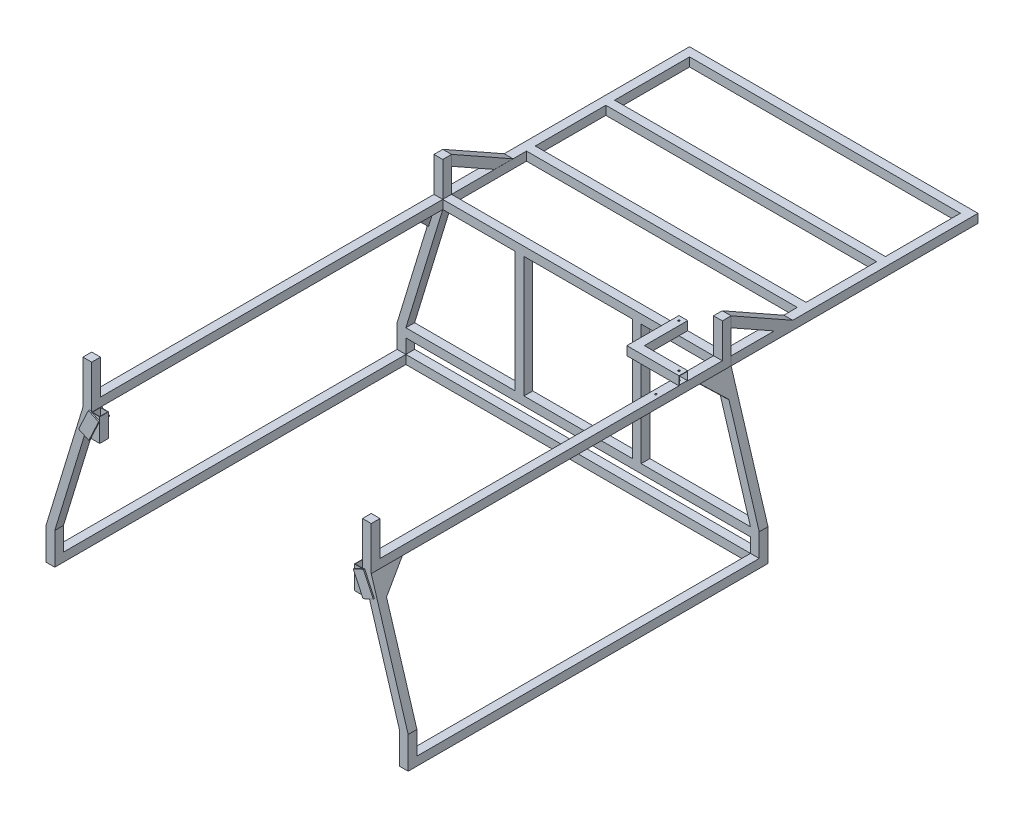
from build123d import *

# Parameters (mm, degrees)
EXTRUDE_THIN1_DEPTH  = 38
SKETCH3_W            = 38
SKETCH3_H            = 38
BOSS_EXTRUDE1_DEPTH  = 100
EXTRUDE_THIN2_DEPTH  = 38
SWEEP1_START         = 742
SWEEP1_DEPTH         = 38
SWEEP2_START         = 742
SWEEP2_DEPTH         = 38
SWEEP3_START         = -780
SWEEP3_DEPTH         = 38
SWEEP4_START         = -780
SWEEP4_DEPTH         = 38
SKETCH13_W           = 38
SKETCH13_H           = 38
BOSS_EXTRUDE2_DEPTH  = 150
RIB1_REACH           = 1837.226
SKETCH16_WALL_W      = 3809.630165696
SKETCH16_WALL_H      = 5
RIB2_REACH           = 1837.226
SKETCH21_WALL_W      = 3809.630165696
SKETCH21_WALL_H      = 5
SKETCH25_W           = 935.216872936
SKETCH25_H           = 953.548523314
CUT_EXTRUDE1_DEPTH   = 1943.247409575
SKETCH26_W           = 38
SKETCH26_H           = 38
SKETCH26_W_2         = 38.33862028
BOSS_EXTRUDE3_DEPTH  = 1070
BOSS_EXTRUDE4_REACH  = 2457.073
SKETCH27_W           = 38
SKETCH27_H           = 38
BOSS_EXTRUDE5_DEPTH  = 38
SKETCH29_W           = 38
SKETCH29_H           = 624
EXTRUDE_THIN3_DEPTH  = 38
SKETCH30_W           = 38
SKETCH30_H           = 624
EXTRUDE_THIN4_DEPTH  = 38
SKETCH31_W           = 1174
SKETCH31_H           = 38
EXTRUDE_THIN5_DEPTH  = 38
BOSS_EXTRUDE6_DEPTH  = 38
BOSS_EXTRUDE7_DEPTH  = 5
BOSS_EXTRUDE8_DEPTH  = 5
SKETCH35_W           = 34.947405688
SKETCH35_H           = 38
BOSS_EXTRUDE11_DEPTH = 100
SHELL1_T             = -1.5
SKETCH36_W           = 943.118643106
SKETCH36_H           = 1032.640089362
CUT_EXTRUDE2_DEPTH   = 2878.837729963
SKETCH38_R           = 4
CUT_EXTRUDE3_DEPTH   = 38
SKETCH40_W           = 31.947405688
SKETCH40_H           = 35
CUT_EXTRUDE5_DEPTH   = 2087.760407905
SKETCH41_W           = 31.947405688
SKETCH41_H           = 35
CUT_EXTRUDE6_DEPTH   = 2087.760407905
EXTRUDE_THIN7_DEPTH  = 38
SKETCH43_R           = 4
CUT_EXTRUDE7_DEPTH   = 2116.884921256
SKETCH45_W           = 34
SKETCH45_H           = 34
SKETCH49_W           = 38
SKETCH49_H           = 38
BOSS_EXTRUDE12_DEPTH = 1494
SKETCH50_W           = 38
SKETCH50_H           = 62
CUT_EXTRUDE8_DEPTH   = 1916.842895438


# Read off the part's stored shape, not the designer's step: Sweep1, Sweep2, Sweep3, Sweep4
with BuildPart() as part:
    # Sketch2 → Extrude-Thin1 (new body)
    with BuildSketch(Plane(origin=(0, 0, 0), x_dir=(1, 0, 0), z_dir=(0, 1, 0))):
        Polygon((785, -780), (785, 780), (-785, 780), (-785, -780), (-747, -780), (-747, 742), (747, 742), (747, -780), align=None)
    extrude(amount=EXTRUDE_THIN1_DEPTH)

    # Sketch3 → Boss-Extrude1 (add)
    with BuildSketch(Plane(origin=(0, 38, 0), x_dir=(1, 0, 0), z_dir=(0, 1, 0))):
        with Locations((-766, 761)):
            Rectangle(SKETCH3_W, SKETCH3_H)
        with Locations((766, 761)):
            Rectangle(SKETCH3_W, SKETCH3_H)
        with Locations((766, -761)):
            Rectangle(SKETCH3_W, SKETCH3_H)
        with Locations((-766, -761)):
            Rectangle(SKETCH3_W, SKETCH3_H)
    extrude(amount=BOSS_EXTRUDE1_DEPTH)



with BuildPart() as body_2:
    # Sketch4 → Extrude-Thin2 (new body)
    with BuildSketch(Plane(origin=(0, 700, 0), x_dir=(1, 0, 0), z_dir=(0, 1, 0))):
        Polygon((625, -780), (625, 780), (-625, 780), (-625, -780), (-587, -780), (-587, 742), (587, 742), (587, -780), align=None)
    extrude(amount=-EXTRUDE_THIN2_DEPTH)


with BuildPart() as part_1:
    add(part.part)

    add(body_2.part)  # Sweep1 merges body 2
    # Sweep1 outline → Sweep1 (add)
    with BuildSketch(Plane.XY.offset(SWEEP1_START)):
        Polygon((-587, 662), (-625, 662), (-785, 138), (-747, 138), align=None)
    extrude(amount=SWEEP1_DEPTH)

    # Sweep2 outline → Sweep2 (add)
    with BuildSketch(Plane.XY.offset(SWEEP2_START)):
        Polygon((747, 138), (785, 138), (625, 662), (587, 662), align=None)
    extrude(amount=SWEEP2_DEPTH)

    # Sweep3 outline → Sweep3 (add)
    with BuildSketch(Plane.XY.offset(SWEEP3_START)):
        Polygon((785, 138), (625, 662), (587, 662), (747, 138), align=None)
    extrude(amount=SWEEP3_DEPTH)

    # Sweep4 outline → Sweep4 (add)
    with BuildSketch(Plane.XY.offset(SWEEP4_START)):
        Polygon((-625, 662), (-785, 138), (-747, 138), (-587, 662), align=None)
    extrude(amount=SWEEP4_DEPTH)

    # Sketch13 → Boss-Extrude2 (add)
    with BuildSketch(Plane(origin=(0, 700, 0), x_dir=(1, 0, 0), z_dir=(0, 1, 0))):
        with Locations((-606, 761)):
            Rectangle(SKETCH13_W, SKETCH13_H)
        with Locations((-606, -761)):
            Rectangle(SKETCH13_W, SKETCH13_H)
        with Locations((606, 761)):
            Rectangle(SKETCH13_W, SKETCH13_H)
        with Locations((606, -761)):
            Rectangle(SKETCH13_W, SKETCH13_H)
    extrude(amount=BOSS_EXTRUDE2_DEPTH)

    # Sketch16 wall → Rib1 (add, up to next)
    with BuildSketch(Plane(origin=(-639.163602773, 615.614200918, 693.5), x_dir=(0.20649854777, 0.676282743952, -0.707106781188), z_dir=(-0.206498547772, -0.676282743954, -0.707106781186)), mode=Mode.PRIVATE) as rib1_sk1:
        with Locations((0, 2.5)):
            Rectangle(SKETCH16_WALL_W, SKETCH16_WALL_H)
    rib1_tool1 = extrude(rib1_sk1.sketch, amount=-RIB1_REACH, mode=Mode.PRIVATE) - part_1.part
    add(rib1_tool1.solids().sort_by_distance((-639.163602773, 615.614200918, 693.5))[0])

    # Sketch21 wall → Rib2 (add, up to next)
    with BuildSketch(Plane(origin=(-639.163602773, 615.614200918, -693.5), x_dir=(-0.20649854777, -0.676282743952, -0.707106781188), z_dir=(-0.206498547772, -0.676282743954, 0.707106781186)), mode=Mode.PRIVATE) as rib2_sk1:
        with Locations((0, 2.5)):
            Rectangle(SKETCH21_WALL_W, SKETCH21_WALL_H)
    rib2_tool1 = extrude(rib2_sk1.sketch, amount=-RIB2_REACH, mode=Mode.PRIVATE) - part_1.part
    add(rib2_tool1.solids().sort_by_distance((-639.163602773, 615.614200918, -693.5))[0])

    # Sketch25 → Cut-Extrude1 (cut, through all)
    with BuildSketch(Plane.XY.offset(780)):
        with Locations((467.608436468, 476.774261657)):
            Rectangle(SKETCH25_W, SKETCH25_H)
    extrude(amount=-CUT_EXTRUDE1_DEPTH, mode=Mode.SUBTRACT)

    # Mirror12: part across plane


with BuildPart() as part_2:
    add(part_1.part)
    add(part_1.part.mirror(Plane(origin=(0, 0, -780), x_dir=(0, 0, 1), z_dir=(-1, 0, 0))))

    # Sketch26 → Boss-Extrude3 (add)
    with BuildSketch(Plane(origin=(0, 0, -780), x_dir=(-1, 0, 0), z_dir=(0, 0, -1))):
        with Locations((-606, 681)):
            Rectangle(SKETCH26_W, SKETCH26_H)
        with Locations((606.16931014, 681)):
            Rectangle(SKETCH26_W_2, SKETCH26_H)
    extrude(amount=BOSS_EXTRUDE3_DEPTH)

    # Sketch27 → Boss-Extrude4 (add, up to next)
    with BuildSketch(Plane.ZY.offset(-587), mode=Mode.PRIVATE) as boss_extrude4_sk1:
        with Locations((-1831, 681)):
            Rectangle(SKETCH27_W, SKETCH27_H)
    boss_extrude4_tool1 = extrude(boss_extrude4_sk1.sketch, amount=BOSS_EXTRUDE4_REACH, mode=Mode.PRIVATE) - part_2.part
    add(boss_extrude4_tool1.solids().sort_by_distance((587, 681, -1831))[0])

    # Sketch28 → Boss-Extrude5 (add)
    with BuildSketch(Plane.ZY.offset(625.33862028)):
        Polygon((-780, 850), (-1046.666666667, 700), (-966.666666667, 700), (-780, 805), align=None)
    extrude(amount=-BOSS_EXTRUDE5_DEPTH)

    # Sketch29 → Extrude-Thin3 (add)
    with BuildSketch(Plane.XY.offset(-742)):
        with Locations((-254, 350)):
            Rectangle(SKETCH29_W, SKETCH29_H)
    extrude(amount=-EXTRUDE_THIN3_DEPTH)

    # Sketch31 → Extrude-Thin5 (add)
    with BuildSketch(Plane(origin=(0, 700, 0), x_dir=(1, 0, 0), z_dir=(0, 1, 0))):
        with Locations((0, 1468)):
            Rectangle(SKETCH31_W, SKETCH31_H)
        with Locations((0, 1124)):
            Rectangle(SKETCH31_W, SKETCH31_H)
    extrude(amount=-EXTRUDE_THIN5_DEPTH)

    # Sketch32 → Boss-Extrude6 (add)
    with BuildSketch(Plane(origin=(625, 0, 0), x_dir=(0, 0, -1), z_dir=(1, 0, 0))):
        Polygon((1046.666666667, 700), (780, 850), (780, 805), (966.666666667, 700), align=None)
    extrude(amount=-BOSS_EXTRUDE6_DEPTH)

    # Sketch33 → Boss-Extrude7 (add)
    with BuildSketch(Plane.XY.offset(780)):
        Polygon((-596.152601999, 666.267928404), (-552.052594312, 645.703757095), (-594.314420486, 555.072978391), (-638.414428173, 575.637149701), align=None)
    extrude(amount=BOSS_EXTRUDE7_DEPTH)

    # Sketch34 → Boss-Extrude8 (add)
    with BuildSketch(Plane(origin=(0, 0, 742), x_dir=(-1, 0, 0), z_dir=(0, 0, -1))):
        Polygon((594.314420486, 555.072978391), (616.491771856, 565.414447173), (587, 662), (552.052594312, 645.703757095), align=None)
        Polygon((616.491771856, 565.414447173), (638.414428173, 575.637149701), (598.142769699, 662), (587, 662), align=None)
    extrude(amount=BOSS_EXTRUDE8_DEPTH)


with BuildPart() as body_2_2:
    # Sketch30 → Extrude-Thin4 (new body)
    with BuildSketch(Plane.XY.offset(-742)):
        with Locations((254, 350)):
            Rectangle(SKETCH30_W, SKETCH30_H)
    extrude(amount=-EXTRUDE_THIN4_DEPTH)


with BuildPart() as body_3:
    # Sketch35 → Boss-Extrude11 (new body)
    with BuildSketch(Plane(origin=(0, 662, 0), x_dir=(1, 0, 0), z_dir=(0, 1, 0))):
        with Locations((-569.526297156, -761)):
            Rectangle(SKETCH35_W, SKETCH35_H)
    extrude(amount=-BOSS_EXTRUDE11_DEPTH)

    # Shell1
    shell1_openings = [body_3.faces().sort_by_distance(p)[0] for p in [
        (-569.526297156, 662, 761),
    ]]
    offset(amount=SHELL1_T, openings=shell1_openings, kind=Kind.INTERSECTION)


with BuildPart() as cut_extrude2_tool:
    # Sketch36 → Cut-Extrude2 (new, through all)
    with BuildSketch(Plane.XY.offset(785)):
        with Locations((471.559321553, 516.320044681)):
            Rectangle(SKETCH36_W, SKETCH36_H)
    extrude(amount=-CUT_EXTRUDE2_DEPTH)


with BuildPart() as part_3:
    add(part_2.part)

    # Cut-Extrude2: cut by cut_extrude2_tool
    add(cut_extrude2_tool.part, mode=Mode.SUBTRACT)


with BuildPart() as body_2_2_1:
    add(body_2_2.part)

    # Cut-Extrude2: cut by cut_extrude2_tool
    add(cut_extrude2_tool.part, mode=Mode.SUBTRACT)


with BuildPart() as body_3_2:
    # Mirror13: mirrored copy
    add(part_3.part.mirror(Plane(origin=(0, 0, -1850), x_dir=(0, 0, 1), z_dir=(-1, 0, 0))))

    # Sketch38 → Cut-Extrude3 (cut)
    with BuildSketch(Plane(origin=(0, 700, 0), x_dir=(1, 0, 0), z_dir=(0, 1, 0))):
        with Locations(Location((418, 761, 0), (0, 0, 270))):
            Circle(SKETCH38_R)
        with Locations(Location((606, 573, 0), (0, 0, 270))):
            Circle(SKETCH38_R)
        with Locations(Location((606, 473, 0), (0, 0, 270))):
            Circle(SKETCH38_R)
    extrude(amount=-CUT_EXTRUDE3_DEPTH, mode=Mode.SUBTRACT)

    # Sketch42 → Extrude-Thin7 (add)
    with BuildSketch(Plane(origin=(0, 700, 0), x_dir=(1, 0, 0), z_dir=(0, 1, 0))):
        Polygon((399, 780), (399, 554), (625, 554), (625, 592), (437, 592), (437, 780), align=None)
    extrude(amount=EXTRUDE_THIN7_DEPTH)

    # Sketch43 → Cut-Extrude7 (cut, through all)
    with BuildSketch(Plane.XZ.offset(-662)):
        with Locations(Location((606, -573, 0), (0, 0, 270))):
            Circle(SKETCH43_R)
        with Locations(Location((418, -761, 0), (0, 0, 270))):
            Circle(SKETCH43_R)
    extrude(amount=-CUT_EXTRUDE7_DEPTH, mode=Mode.SUBTRACT)

    # Cut-Sweep3: sweep along a path in Sketch48
    with BuildLine(Plane(origin=(0, 712.5, 0), x_dir=(1, 0, 0), z_dir=(0, 1, 0))) as cut_sweep3_path:
        Line((625, 573), (418, 573))
        Line((418, 573), (418, 780))
    # Sketch45 → Cut-Sweep3 (sweep, cut)
    with BuildSketch(Plane(origin=(625, 0, 0), x_dir=(0, 0, -1), z_dir=(1, 0, 0))):
        with Locations((573, 719)):
            Rectangle(SKETCH45_W, SKETCH45_H)
    sweep(path=cut_sweep3_path.line, transition=Transition.RIGHT, mode=Mode.SUBTRACT)


with BuildPart() as body_4:
    # Mirror13 2: mirrored copy
    add(body_3.part.mirror(Plane(origin=(0, 0, -1850), x_dir=(0, 0, 1), z_dir=(-1, 0, 0))))

    # Sketch41 → Cut-Extrude6 (cut, through all)
    with BuildSketch(Plane.XZ.offset(-562)):
        with Locations((569.526297156, 761)):
            Rectangle(SKETCH41_W, SKETCH41_H)
    extrude(amount=-CUT_EXTRUDE6_DEPTH, mode=Mode.SUBTRACT)


with BuildPart() as body_3_1:
    add(body_3.part)

    # Sketch40 → Cut-Extrude5 (cut, through all)
    with BuildSketch(Plane.XZ.offset(-562)):
        with Locations((-569.526297156, 761)):
            Rectangle(SKETCH40_W, SKETCH40_H)
    extrude(amount=-CUT_EXTRUDE5_DEPTH, mode=Mode.SUBTRACT)


with BuildPart() as part_4:
    add(part_3.part)

    add(body_3_2.part)  # Boss-Extrude12 merges body 3 2
    # Sketch49 → Boss-Extrude12 (add)
    with BuildSketch(Plane.ZY.offset(-747)):
        with Locations((-761, 119)):
            Rectangle(SKETCH49_W, SKETCH49_H)
    extrude(amount=BOSS_EXTRUDE12_DEPTH)

    # Sketch50 → Cut-Extrude8 (cut, through all)
    with BuildSketch(Plane.XY.offset(-742)):
        with Locations((-254, 69)):
            Rectangle(SKETCH50_W, SKETCH50_H)
        with Locations((254, 69)):
            Rectangle(SKETCH50_W, SKETCH50_H)
    extrude(amount=-CUT_EXTRUDE8_DEPTH, mode=Mode.SUBTRACT)


solid = Compound([body_4.part, body_3_1.part, part_4.part])
